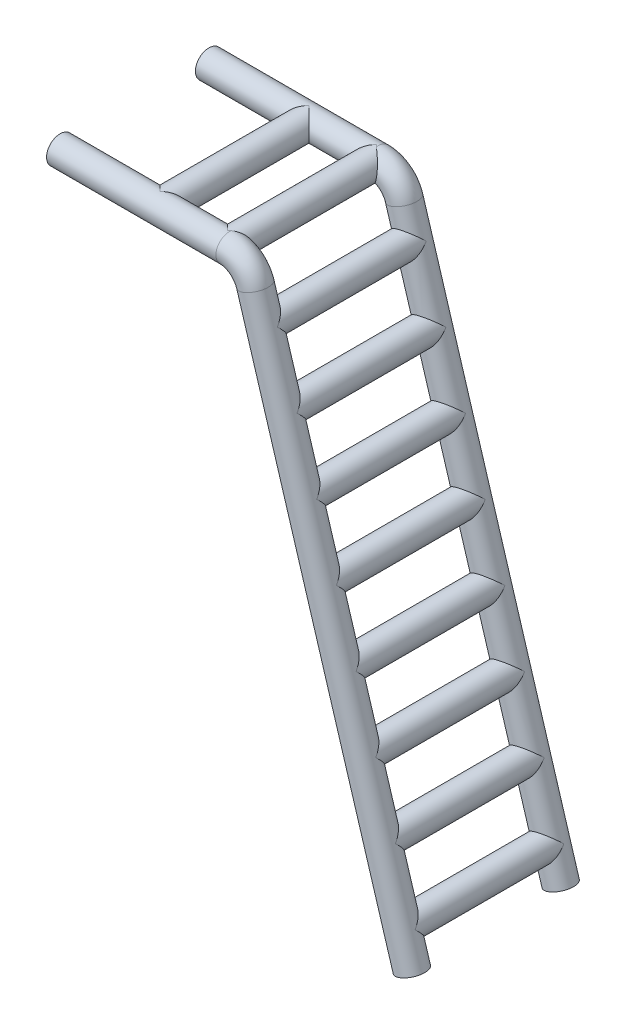
from build123d import *

# Parameters (mm, degrees)
SKETCH2_R             = 5
SKETCH4_R             = 5
BOSS_EXTRUDE1_DEPTH   = 55
CRVPATTERN1_START     = -1e-07
CRVPATTERN1_OUTLINE_R = 5
CRVPATTERN1_DEPTH     = 55.0000001


# Read off the part's stored shape, not the designer's step: CrvPattern1
with BuildPart() as part:
    # Sweep1: sweep along a path in Sketch1
    with BuildLine(Plane.XY) as sweep1_path:
        Line((0, 197.5), (62.586692935, 197.5))
        ThreePointArc((62.586692935, 197.5), (68.542028244, 195.533304511), (72.154897335, 190.406796273))
        Line((72.154897335, 190.406796273), (130, 0))
    # Sketch2 → Sweep1 (sweep)
    with BuildSketch(Plane(origin=(0, 0, 0), x_dir=(0, 0, -1), z_dir=(1, 0, 0))):
        with Locations((0, 197.5)):
            Circle(SKETCH2_R)
    sweep1 = sweep(path=sweep1_path.line)

    # Sketch4 → Boss-Extrude1 (add)
    with BuildSketch(Plane.XY):
        with Locations(Location((126.387902166, 11.889822036, 0), (0, 0, 196.898648694))):
            Circle(SKETCH4_R)
    extrude(amount=BOSS_EXTRUDE1_DEPTH)

    # CrvPattern1 outline → CrvPattern1 (add)
    with BuildSketch(Plane.XY.offset(CRVPATTERN1_START)):
        with Locations((119.120911483, 35.810333034)):
            Circle(CRVPATTERN1_OUTLINE_R)
        with Locations((111.8539208, 59.730844032)):
            Circle(CRVPATTERN1_OUTLINE_R)
        with Locations((104.586930117, 83.65135503)):
            Circle(CRVPATTERN1_OUTLINE_R)
        with Locations((97.319939434, 107.571866029)):
            Circle(CRVPATTERN1_OUTLINE_R)
        with Locations((90.052948751, 131.492377027)):
            Circle(CRVPATTERN1_OUTLINE_R)
        with Locations((82.785958068, 155.412888025)):
            Circle(CRVPATTERN1_OUTLINE_R)
        with Locations((75.518967385, 179.333399023)):
            Circle(CRVPATTERN1_OUTLINE_R)
        with Locations((61.918405072, 197.5)):
            Circle(CRVPATTERN1_OUTLINE_R)
        with Locations((36.918405072, 197.5)):
            Circle(CRVPATTERN1_OUTLINE_R)
    crvpattern1 = extrude(amount=CRVPATTERN1_DEPTH)

    # Mirror1: Sweep1, CrvPattern1 across plane
    add(sweep1.mirror(Plane.XY.offset(27.5)))
    add(crvpattern1.mirror(Plane.XY.offset(27.5)))


solid = part.part
